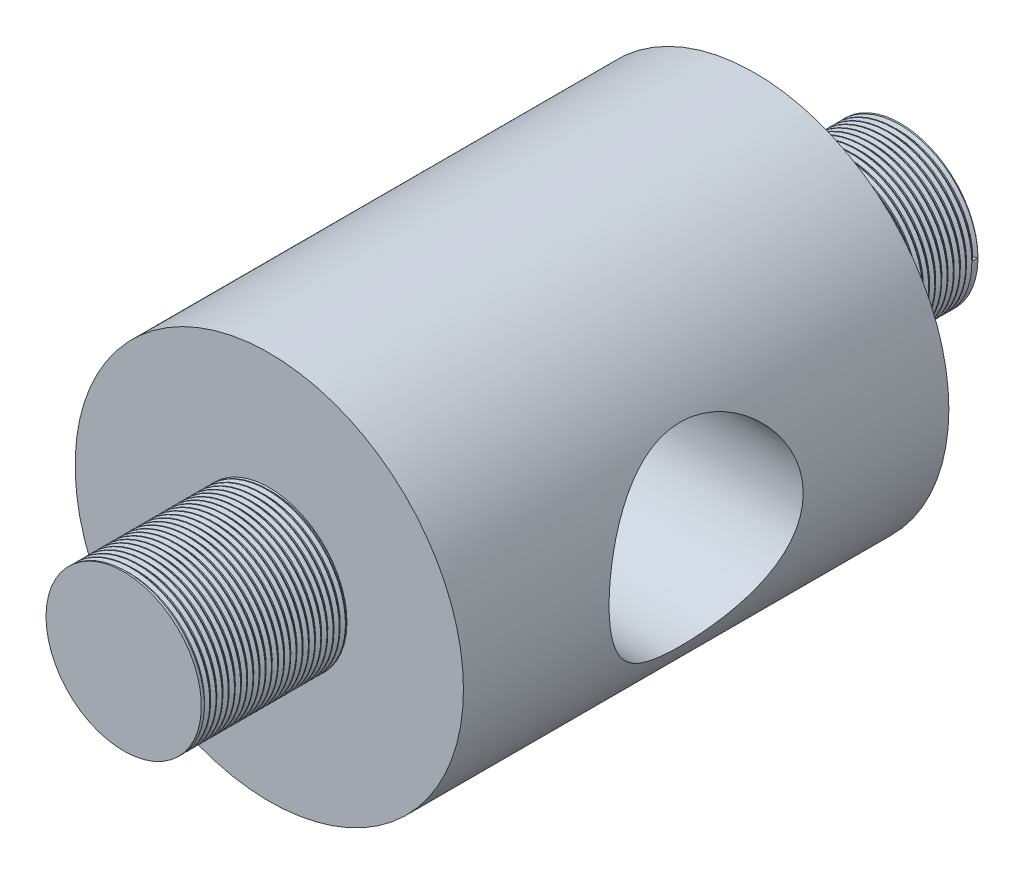
from build123d import *

# Parameters (mm, degrees)
SKETCH1_R           = 10
BOSS_EXTRUDE1_DEPTH = 25
SKETCH2_R           = 4
BOSS_EXTRUDE2_DEPTH = 7.5
BOSS_EXTRUDE3_START = 7.5
SKETCH3_R           = 4
BOSS_EXTRUDE3_DEPTH = 7.5
THREAD1_PITCH       = 0.3175
THREAD2_PITCH       = 0.3175
SKETCH9_R           = 5
CUT_EXTRUDE1_DEPTH  = 40.449335248


with BuildPart() as part:
    # Sketch1 → Boss-Extrude1 (new body)
    with BuildSketch(Plane.XY):
        Circle(SKETCH1_R)
    extrude(amount=BOSS_EXTRUDE1_DEPTH)

    # Sketch2 → Boss-Extrude2 (add)
    with BuildSketch(Plane.XY.offset(25)):
        Circle(SKETCH2_R)
    extrude(amount=BOSS_EXTRUDE2_DEPTH)

    # Sketch3 → Boss-Extrude3 (add)
    with BuildSketch(Plane(origin=(0, 0, 0), x_dir=(-1, 0, 0), z_dir=(0, 0, -1)).offset(BOSS_EXTRUDE3_START)):
        Circle(SKETCH3_R)
    extrude(amount=-BOSS_EXTRUDE3_DEPTH)

    # Thread1: arcs per turn and ends read off the stored shape
    # Thread1: the profile of Thread Profile1 profile screwed along a right-hand helix through 31.496063 turns, 6 arcs to a turn; built about Z, then put on its axis
    thread1_z = Axis((0, 0, 0), (0, 0, 1))
    thread1_corners = [(4.0003, 0, -0.000173205), (4.0003, 0, 0.277985704), (3.828148085, 0, 0.17859375), (3.828148085, 0, 0.09921875)]
    with BuildLine(mode=Mode.PRIVATE) as thread1_profile:
        Line(thread1_corners[0], thread1_corners[1])
        Line(thread1_corners[1], thread1_corners[2])
        Line(thread1_corners[2], thread1_corners[3])
        Line(thread1_corners[3], thread1_corners[0])
    thread1_cap = Face(thread1_profile.wire())
    thread1_turn_angles = [0, 30, 60, 90, 120, 150, 180, 210, 240, 270, 300, 330, 360]
    thread1_turn_weights = [1, 0.8660254037844387, 1, 0.8660254037844387, 1, 0.8660254037844387, 1, 0.8660254037844387, 1, 0.8660254037844387, 1, 0.8660254037844387, 1]
    thread1_turn_rails = [Edge.make_bspline([Vector(p[0], p[1], 0).rotate(thread1_z, thread1_turn_angles[k]) / thread1_turn_weights[k] + Vector(0, 0, p[2] + THREAD1_PITCH * thread1_turn_angles[k] / 360) for k in range(13)], [0, 0, 0, 1, 1, 2, 2, 3, 3, 4, 4, 5, 5, 6, 6, 6], 2, thread1_turn_weights) for p in thread1_corners]
    thread1_turn_sides = [Face.make_surface_from_curves(thread1_turn_rails[p[0]], thread1_turn_rails[p[1]]) for p in [(0, 1), (1, 2), (2, 3), (3, 0)]]
    thread1_last_angles = [11160, 11190, 11220, 11250, 11280, 11309.291338583, 11338.582677165]
    thread1_last_weights = [1, 0.8660254037844387, 1, 0.8660254037844387, 1, 0.872143242535045, 1]
    thread1_last_rails = [Edge.make_bspline([Vector(p[0], p[1], 0).rotate(thread1_z, thread1_last_angles[k]) / thread1_last_weights[k] + Vector(0, 0, p[2] + THREAD1_PITCH * thread1_last_angles[k] / 360) for k in range(7)], [0, 0, 0, 1, 1, 2, 2, 3, 3, 3], 2, thread1_last_weights) for p in thread1_corners]
    thread1_last_sides = [Face.make_surface_from_curves(thread1_last_rails[p[0]], thread1_last_rails[p[1]]) for p in [(0, 1), (1, 2), (2, 3), (3, 0)]]
    thread1 = Plane(origin=(0, 0, -7.5), x_dir=(1, 0, 0), z_dir=(0, 0, 1)) * Solid(Shell([*[p.moved(Location((0, 0, THREAD1_PITCH * i))) for i in range(31) for p in thread1_turn_sides], *thread1_last_sides, thread1_cap, thread1_cap.rotate(thread1_z, 11338.582677165).moved(Location((0, 0, THREAD1_PITCH * 11338.582677165 / 360)))]))
    add(thread1, mode=Mode.SUBTRACT)

    # Thread2: arcs per turn and ends read off the stored shape
    # Thread2: the profile of Thread Profile2 profile screwed along a right-hand helix through 31.496063 turns, 6 arcs to a turn; built about Z, then put on its axis
    thread2_z = Axis((0, 0, 0), (0, 0, 1))
    thread2_corners = [(4.0003, 0, -0.000173205), (4.0003, 0, 0.277985704), (3.828148085, 0, 0.17859375), (3.828148085, 0, 0.09921875)]
    with BuildLine(mode=Mode.PRIVATE) as thread2_profile:
        Line(thread2_corners[0], thread2_corners[1])
        Line(thread2_corners[1], thread2_corners[2])
        Line(thread2_corners[2], thread2_corners[3])
        Line(thread2_corners[3], thread2_corners[0])
    thread2_cap = Face(thread2_profile.wire())
    thread2_turn_angles = [0, 30, 60, 90, 120, 150, 180, 210, 240, 270, 300, 330, 360]
    thread2_turn_weights = [1, 0.8660254037844387, 1, 0.8660254037844387, 1, 0.8660254037844387, 1, 0.8660254037844387, 1, 0.8660254037844387, 1, 0.8660254037844387, 1]
    thread2_turn_rails = [Edge.make_bspline([Vector(p[0], p[1], 0).rotate(thread2_z, thread2_turn_angles[k]) / thread2_turn_weights[k] + Vector(0, 0, p[2] + THREAD2_PITCH * thread2_turn_angles[k] / 360) for k in range(13)], [0, 0, 0, 1, 1, 2, 2, 3, 3, 4, 4, 5, 5, 6, 6, 6], 2, thread2_turn_weights) for p in thread2_corners]
    thread2_turn_sides = [Face.make_surface_from_curves(thread2_turn_rails[p[0]], thread2_turn_rails[p[1]]) for p in [(0, 1), (1, 2), (2, 3), (3, 0)]]
    thread2_last_angles = [11160, 11190, 11220, 11250, 11280, 11309.291338583, 11338.582677165]
    thread2_last_weights = [1, 0.8660254037844387, 1, 0.8660254037844387, 1, 0.872143242535045, 1]
    thread2_last_rails = [Edge.make_bspline([Vector(p[0], p[1], 0).rotate(thread2_z, thread2_last_angles[k]) / thread2_last_weights[k] + Vector(0, 0, p[2] + THREAD2_PITCH * thread2_last_angles[k] / 360) for k in range(7)], [0, 0, 0, 1, 1, 2, 2, 3, 3, 3], 2, thread2_last_weights) for p in thread2_corners]
    thread2_last_sides = [Face.make_surface_from_curves(thread2_last_rails[p[0]], thread2_last_rails[p[1]]) for p in [(0, 1), (1, 2), (2, 3), (3, 0)]]
    thread2 = Plane(origin=(0, 0, 32.5), x_dir=(-1, 0, 0), z_dir=(0, 0, -1)) * Solid(Shell([*[p.moved(Location((0, 0, THREAD2_PITCH * i))) for i in range(31) for p in thread2_turn_sides], *thread2_last_sides, thread2_cap, thread2_cap.rotate(thread2_z, 11338.582677165).moved(Location((0, 0, THREAD2_PITCH * 11338.582677165 / 360)))]))
    add(thread2, mode=Mode.SUBTRACT)

    # Sketch9 → Cut-Extrude1 (cut, through all)
    with BuildSketch(Plane(origin=(10, 0, 0), x_dir=(0, 0, -1), z_dir=(1, 0, 0))):
        with Locations((-12.5, 0)):
            Circle(SKETCH9_R)
    extrude(amount=-CUT_EXTRUDE1_DEPTH, mode=Mode.SUBTRACT)


solid = part.part
